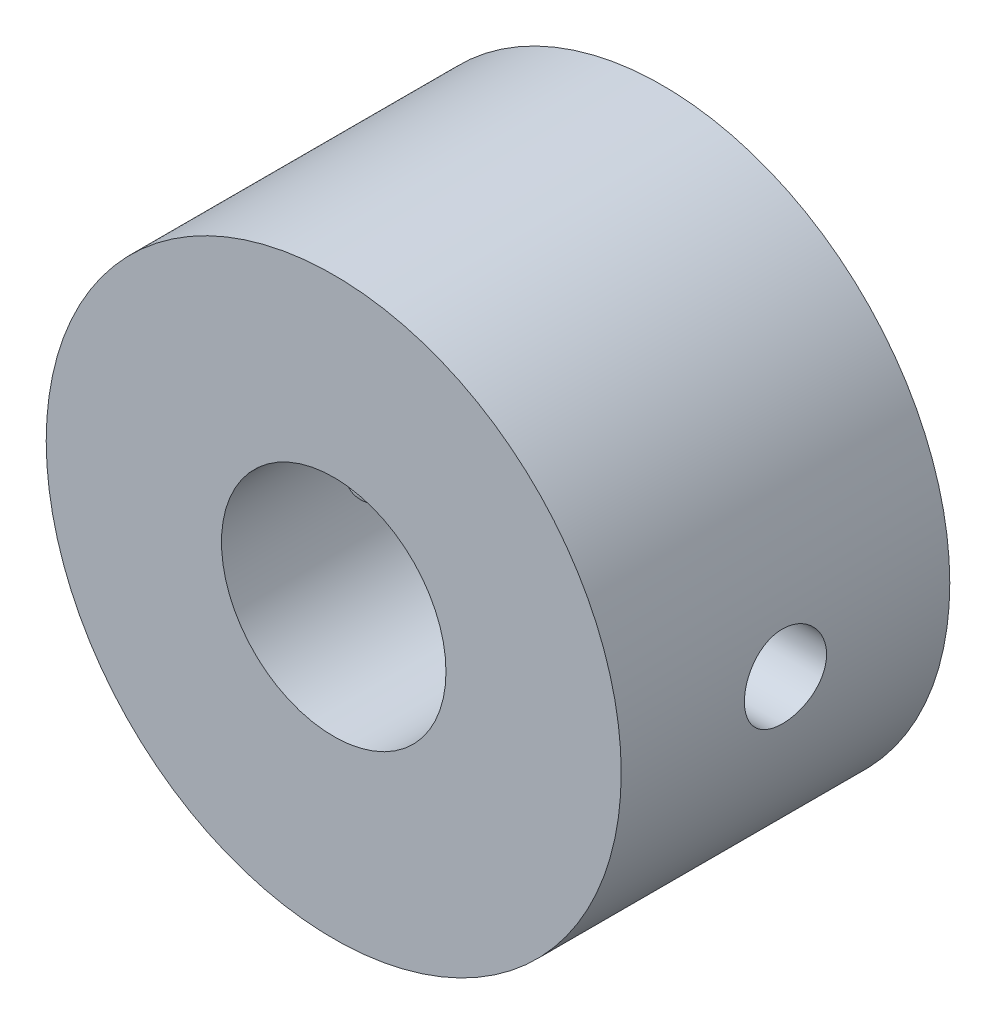
from build123d import *

# Parameters (mm, degrees)
SKETCH1_R               = 10.5
BOSS_EXTRUDE1_DEPTH     = 12
SKETCH2_R               = 4.1
CUT_EXTRUDE1_DEPTH      = 15
CUT_EXTRUDE2_DEPTH      = 20.091883092
CUT_EXTRUDE2_DEPTH_BACK = 20.091883092
SKETCH3_R               = 1.5


with BuildPart() as part:
    # Sketch1 → Boss-Extrude1 (new body)
    with BuildSketch(Plane.XY):
        Circle(SKETCH1_R)
    extrude(amount=BOSS_EXTRUDE1_DEPTH)

    # Sketch2 → Cut-Extrude1 (cut)
    with BuildSketch(Plane.XY.offset(12)):
        Circle(SKETCH2_R)
    extrude(amount=-CUT_EXTRUDE1_DEPTH, mode=Mode.SUBTRACT)

    # Sketch3 → Cut-Extrude2 (cut, two sides: drawn at the far end of the back side and taken through both)
    with BuildSketch(Plane(origin=(0, 0, 0), x_dir=(0, 0, -1), z_dir=(1, 0, 0)).offset(-CUT_EXTRUDE2_DEPTH_BACK)):
        with Locations((-6, 0)):
            Circle(SKETCH3_R)
    extrude(amount=CUT_EXTRUDE2_DEPTH + CUT_EXTRUDE2_DEPTH_BACK, mode=Mode.SUBTRACT)


solid = part.part
